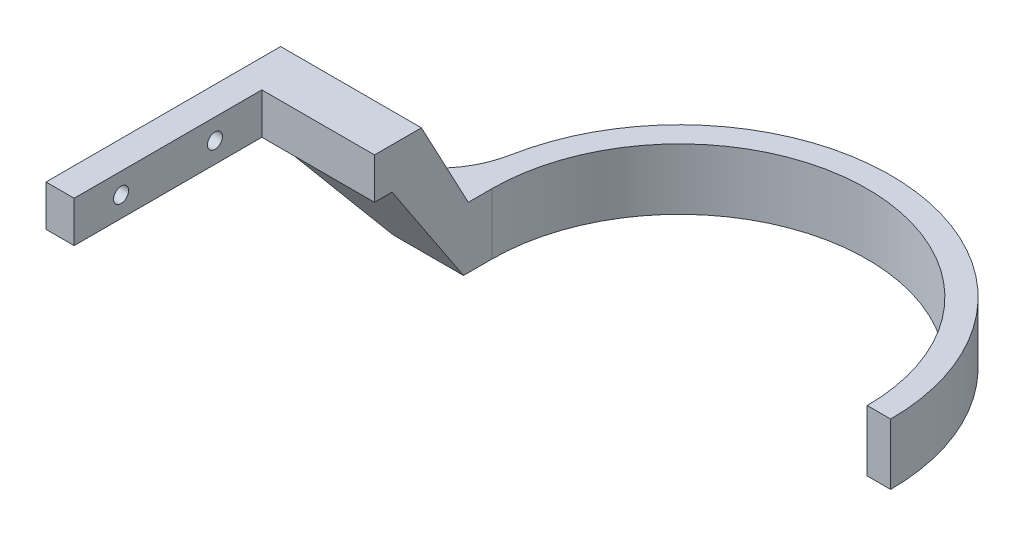
from build123d import *

# Parameters (mm, degrees)
EXTRUDE_1_DEPTH          = 13
SKETCH_2_W               = 30
SKETCH_2_H               = 13
EXTRUDE_2_DEPTH          = 5
EXTRUDE_3_DEPTH          = 30
SKETCH_4_W               = 30
SKETCH_4_H               = 8.75
EXTRUDE_4_DEPTH          = 10
CUT_EXTRUDE_3_DEPTH      = 86.302769592
CUT_EXTRUDE_3_DEPTH_BACK = 86.302769592
SKETCH_9_W               = 40
SKETCH_9_H               = 8.75
EXTRUDE_5_DEPTH          = 6
SKETCH_10_R              = 1.6
CUT_EXTRUDE_4_DEPTH      = 131.820726569
PATTERN_LINEAR_1_COUNT   = 2
PATTERN_LINEAR_1_PITCH   = 20
CHAMFER_3_SIZE           = 30
CHAMFER_3_SIZE_2         = 6.247089083
FILLET_1_R               = 20


with BuildPart() as part:
    # 草圖1 → 填料-伸長1 (new body)
    with BuildSketch(Plane(origin=(0, 0, 0), x_dir=(1, 0, 0), z_dir=(0, 1, 0))):
        with BuildLine():
            Line((-45, 0), (-40, 0))
            ThreePointArc((-40, 0), (0, 40), (40, 0))
            Line((40, 0), (45, 0))
            ThreePointArc((45, 0), (0, 45), (-45, 0))
        make_face()
    extrude(amount=EXTRUDE_1_DEPTH)

    # 草圖2 → 填料-伸長2 (add)
    with BuildSketch(Plane.XY):
        with Locations((-55, 6.5)):
            Rectangle(SKETCH_2_W, SKETCH_2_H)
    extrude(amount=EXTRUDE_2_DEPTH)

    # 草圖3 → 填料-伸長3 (add)
    with BuildSketch(Plane(origin=(-40, 0, 0), x_dir=(0, 0, -1), z_dir=(1, 0, 0))):
        Polygon((-5, 0), (-5, 13), (-15, 31.75), (-15, 23), align=None)
    extrude(amount=-EXTRUDE_3_DEPTH)

    # 草圖4 → 填料-伸長4 (add)
    with BuildSketch(Plane.XY.offset(15)):
        with Locations((-55, 27.375)):
            Rectangle(SKETCH_4_W, SKETCH_4_H)
    extrude(amount=EXTRUDE_4_DEPTH)

    # 草圖8 → 除料-伸長3 (cut, two sides: drawn at the far end of the back side and taken through both)
    with BuildSketch(Plane(origin=(0, 13, 0), x_dir=(1, 0, 0), z_dir=(0, 1, 0)).offset(-CUT_EXTRUDE_3_DEPTH_BACK)):
        Polygon((-45, 0), (-70, -15), (-70, 0), align=None)
    extrude(amount=CUT_EXTRUDE_3_DEPTH + CUT_EXTRUDE_3_DEPTH_BACK, mode=Mode.SUBTRACT)

    # 草圖9 → 填料-伸長5 (add)
    with BuildSketch(Plane.ZY.offset(70)):
        with Locations((45, 27.375)):
            Rectangle(SKETCH_9_W, SKETCH_9_H)
    extrude(amount=-EXTRUDE_5_DEPTH)

    # 草圖10 → 除料-伸長4 (cut, through all)
    with BuildSketch(Plane(origin=(-64, 0, 0), x_dir=(0, 0, -1), z_dir=(1, 0, 0))):
        with Locations((-35, 27.375)):
            Circle(SKETCH_10_R)
    cut_extrude_4 = extrude(amount=-CUT_EXTRUDE_4_DEPTH, mode=Mode.SUBTRACT)

    # 直線複製排列1: 除料-伸長4 ×2
    with Locations(*[(0, 0, i * PATTERN_LINEAR_1_PITCH) for i in range(1, PATTERN_LINEAR_1_COUNT)]):
        add(cut_extrude_4, mode=Mode.SUBTRACT)

    # 導角3
    # the kernel refuses this chamfer: 30, 6.247089083 mm, written as the material it adds along each edge
    with BuildSketch(Plane(origin=(-40, 23, 15), x_dir=(0, -0.9143850797176141, -0.4048455581944953), z_dir=(-1, 0, 0))) as chamfer_3_piece_1_section:
        Polygon((CHAMFER_3_SIZE * 0.999977671636, CHAMFER_3_SIZE * 0.0066825316561), (-CHAMFER_3_SIZE_2 * 0.404845558197, CHAMFER_3_SIZE_2 * 0.914385079723), (0, 0), align=None)
    chamfer_3_piece_1 = extrude(amount=30, mode=Mode.PRIVATE)
    chamfer_3_piece_1 = split(chamfer_3_piece_1, bisect_by=Plane(origin=(-53.38759528, 0, 13.91258777), z_dir=(0, 1, 0)), keep=Keep.TOP, mode=Mode.PRIVATE)
    chamfer_3_piece_1 = split(chamfer_3_piece_1, bisect_by=Plane(origin=(-57.305255839, 15.236001875, 7.383153504), z_dir=(0.5144957554275266, 0, 0.8574929257125442)), keep=Keep.TOP, mode=Mode.PRIVATE)
    add(chamfer_3_piece_1)

    # 圓角1
    fillet_1_edges = [part.edges().sort_by_distance(p)[0] for p in [
        (-45, 6.5, 0),
    ]]
    fillet(fillet_1_edges, radius=FILLET_1_R)


solid = part.part
